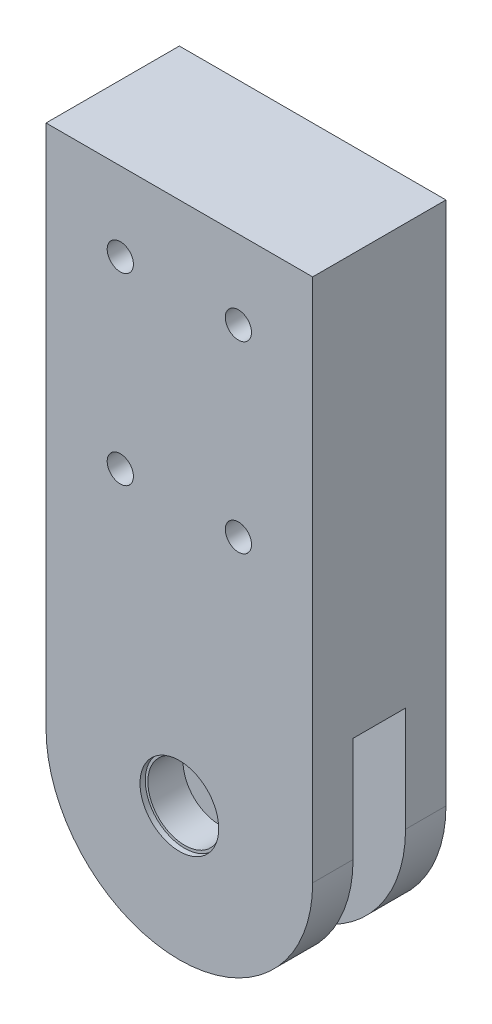
from build123d import *

# Parameters (mm, degrees)
SKETCH1_R           = 7
SKETCH1_R_2         = 2.5
BOSS_EXTRUDE1_DEPTH = 25.4
SKETCH2_W           = 10
SKETCH2_H           = 45.4
CUT_EXTRUDE1_DEPTH  = 116.003478208
SKETCH3_R           = 7.5
CUT_EXTRUDE2_DEPTH  = 1
CUT_EXTRUDE3_START  = -1
SKETCH4_R           = 7.5
CUT_EXTRUDE3_DEPTH  = 1


with BuildPart() as part:
    # Sketch1 → Boss-Extrude1 (new body)
    with BuildSketch(Plane.XY):
        with BuildLine():
            Line((-25.4, 0), (-25.4, 100))
            Line((-25.4, 100), (25.4, 100))
            Line((25.4, 100), (25.4, 0))
            ThreePointArc((25.4, 0), (0, -25.4), (-25.4, 0))
        make_face()
        Circle(SKETCH1_R, mode=Mode.SUBTRACT)
        with Locations((-11.25, 85)):
            Circle(SKETCH1_R_2, mode=Mode.SUBTRACT)
        with Locations((11.25, 85)):
            Circle(SKETCH1_R_2, mode=Mode.SUBTRACT)
        with Locations((11.25, 50)):
            Circle(SKETCH1_R_2, mode=Mode.SUBTRACT)
        with Locations((-11.25, 50)):
            Circle(SKETCH1_R_2, mode=Mode.SUBTRACT)
    extrude(amount=BOSS_EXTRUDE1_DEPTH)

    # Sketch2 → Cut-Extrude1 (cut, through all)
    with BuildSketch(Plane(origin=(25.4, 0, 0), x_dir=(0, 0, -1), z_dir=(1, 0, 0))):
        with Locations((-12.7, -2.7)):
            Rectangle(SKETCH2_W, SKETCH2_H)
    extrude(amount=-CUT_EXTRUDE1_DEPTH, mode=Mode.SUBTRACT)

    # Sketch3 → Cut-Extrude2 (cut)
    with BuildSketch(Plane.XY.offset(25.4)):
        Circle(SKETCH3_R)
    extrude(amount=-CUT_EXTRUDE2_DEPTH, mode=Mode.SUBTRACT)

    # Sketch4 → Cut-Extrude3 (cut)
    with BuildSketch(Plane(origin=(0, 0, 0), x_dir=(-1, 0, 0), z_dir=(0, 0, -1)).offset(CUT_EXTRUDE3_START)):
        Circle(SKETCH4_R)
    extrude(amount=CUT_EXTRUDE3_DEPTH, mode=Mode.SUBTRACT)


solid = part.part
